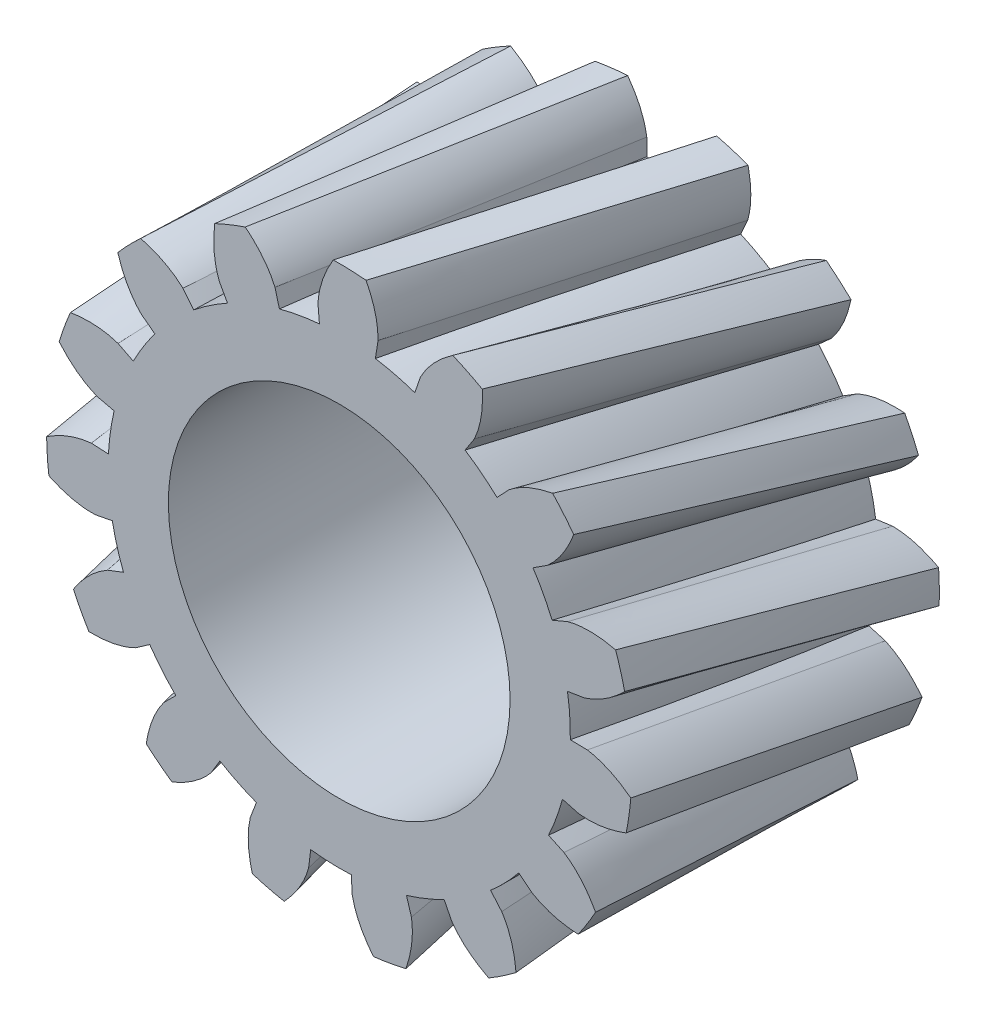
from build123d import *

# Parameters (mm, degrees)
SKETCH2_R           = 10.145
BOSS_EXTRUDE1_DEPTH = 13.5
CIRPATTERN1_COUNT   = 15
SKETCH5_R           = 7.5
CUT_EXTRUDE1_DEPTH  = 23.632676772
SKETCH6_W           = 5
SKETCH6_H           = 2.3
CUT_EXTRUDE2_DEPTH  = 6


with BuildPart() as part:
    # Sketch2 → Boss-Extrude1 (new body)
    with BuildSketch(Plane.XY):
        Circle(SKETCH2_R)
    extrude(amount=BOSS_EXTRUDE1_DEPTH)

    # Loft1: read off the stored shape, not the designer's step
    # Loft1: loft between two sections, ruled curve by curve
    loft1_from = [
        Edge.make_bspline([(0, 10.145, 0), (0, 10.27, 0), (0, 10.395, 0), (0, 10.645, 0), (0, 10.77, 0), (0, 10.895, 0)], [0, 0, 0, 0, 0.5, 0.5, 1, 1, 1, 1], 3),
        Edge.make_bspline([(-2.620067357, 10.575266996, 0), (-2.590006924, 10.453935342, 0), (-2.559946491, 10.332603688, 0), (-2.499825624, 10.089940379, 0), (-2.469765191, 9.968608724, 0), (-2.439704758, 9.84727707, 0)], [0, 0, 0, 0, 0.5, 0.5, 1, 1, 1, 1], 3),
        Edge.make_bspline([(0, 10.895, 0), (-0.100901979, 11.593890763, 0), (-0.421131663, 12.247345433, 0), (-0.837499814, 12.817668238, 0)], [0, 0, 0, 0, 1, 1, 1, 1], 3),
        Edge.make_bspline([(-0.837499814, 12.817668238, 0), (-1.317861548, 12.786281651, 0), (-1.795702748, 12.727969561, 0), (-2.269515374, 12.642915999, 0)], [0, 0, 0, 0, 1, 1, 1, 1], 3, [1, 0.998948017, 0.998948017, 1]),
        Edge.make_bspline([(-2.269515374, 12.642915999, 0), (-2.53651019, 11.989203292, 0), (-2.690199088, 11.277921756, 0), (-2.620067357, 10.575266996, 0)], [0, 0, 0, 0, 1, 1, 1, 1], 3),
        Edge.make_line((-2.439704758, 9.84727707, 0), (0, 10.145, 0)),
    ]
    loft1_to = [
        Edge.make_bspline([(-2.625719213, 9.799317508, 13.5), (-2.658071593, 9.920058236, 13.5), (-2.690423974, 10.040798964, 13.5), (-2.755128735, 10.282280421, 13.5), (-2.787481116, 10.403021149, 13.5), (-2.819833496, 10.523761877, 13.5)], [0, 0, 0, 0, 0.5, 0.5, 1, 1, 1, 1], 3),
        Edge.make_bspline([(-5.267871232, 9.53680018, 13.5), (-5.207432141, 9.427383014, 13.5), (-5.146993049, 9.317965848, 13.5), (-5.026114866, 9.099131517, 13.5), (-4.965675774, 8.989714351, 13.5), (-4.905236682, 8.880297185, 13.5)], [0, 0, 0, 0, 0.5, 0.5, 1, 1, 1, 1], 3),
        Edge.make_bspline([(-2.819833496, 10.523761877, 13.5), (-3.098183564, 11.172723161, 13.5), (-3.5766282, 11.721030363, 13.5), (-4.126419354, 12.164155882, 13.5)], [0, 0, 0, 0, 1, 1, 1, 1], 3),
        Edge.make_bspline([(-4.126419354, 12.164155882, 13.5), (-4.582289712, 12.009512001, 13.5), (-5.028756589, 11.829512445, 13.5), (-5.464410959, 11.624725282, 13.5)], [0, 0, 0, 0, 1, 1, 1, 1], 3, [1, 0.998948017, 0.998948017, 1]),
        Edge.make_bspline([(-5.464410959, 11.624725282, 13.5), (-5.553114849, 10.924183951, 13.5), (-5.517473716, 10.197361132, 13.5), (-5.267871232, 9.53680018, 13.5)], [0, 0, 0, 0, 1, 1, 1, 1], 3),
        Edge.make_line((-4.905236682, 8.880297185, 13.5), (-2.625719213, 9.799317508, 13.5)),
    ]
    loft1 = Solid(Shell([*[Face.make_surface_from_curves(loft1_from[k], loft1_to[k]) for k in range(6)], Face(Wire(loft1_from)), Face(Wire(loft1_to))]))
    add(loft1)

    # CirPattern1: Loft1 ×15 about axis
    cirpattern1_axis = Axis((0, 0, 0), (0, 0, -1))
    for i in range(1, CIRPATTERN1_COUNT):
        add(loft1.rotate(cirpattern1_axis, i * 360 / CIRPATTERN1_COUNT))

    # Sketch5 → Cut-Extrude1 (cut, through all)
    with BuildSketch(Plane(origin=(0, 0, 0), x_dir=(-1, 0, 0), z_dir=(0, 0, -1))):
        Circle(SKETCH5_R)
    extrude(amount=-CUT_EXTRUDE1_DEPTH, mode=Mode.SUBTRACT)

    # Sketch6 → Cut-Extrude2 (cut)
    with BuildSketch(Plane(origin=(0, 0, 0), x_dir=(-1, 0, 0), z_dir=(0, 0, -1))):
        with Locations((0, 8.221067812)):
            Rectangle(SKETCH6_W, SKETCH6_H)
    extrude(amount=-CUT_EXTRUDE2_DEPTH, mode=Mode.SUBTRACT)


solid = part.part
